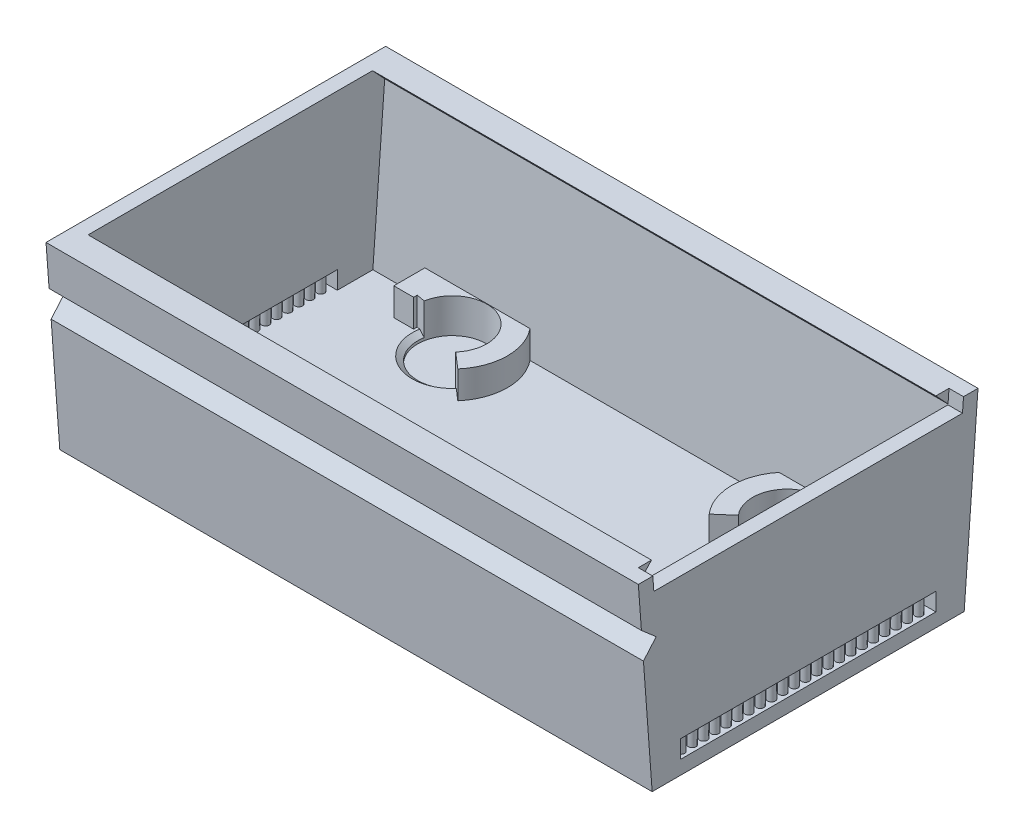
from build123d import *
from OCP.BRepFilletAPI import BRepFilletAPI_MakeChamfer

# Parameters (mm, degrees)
ESBO_O1_W                   = 83.7
ESBO_O1_H                   = 45.2
BASE_DEPTH                  = 2
PAREDES_LATERAIS_DEPTH      = 83.7
PAREDE_CORPO_DEPTH          = 2.1
PAREDE_CABE_A_DEPTH         = 2.1
TRILHO_START                = -2.1
TRILHO_TAMPA_DEPTH          = 81.6
TRILHO_CORE_REACH           = 103.58
CORTE_TRILHO_CORE_DEPTH     = 102.579919275
ESBO_O19_W                  = 37
ESBO_O19_H                  = 2.59
CORTE_CONECTOR_CABE_A_DEPTH = 2.1
ESBO_O20_W                  = 31
ESBO_O20_H                  = 2.59
CORTE_CONECTOR_CORPO_DEPTH  = 2.1
ESBO_O21_W                  = 4
ESBO_O21_H                  = 4.5
APOIO_CONECTOR_CABE_A_DEPTH = 4
ESBO_O22_R                  = 5
CORTE_IM_DEPTH              = 1
RESSALTO_EXTRUS_O15_START   = 4
RESSALTO_EXTRUS_O15_DEPTH   = 4
CHANFRO7_SIZE               = 0.60284324
CHANFRO7_SIZE_2             = 0.8
ESBO_O25_R                  = 0.55
RESSALTO_EXTRUS_O16_DEPTH   = 2.6
ESBO_O27_R                  = 0.55
RESSALTO_EXTRUS_O17_DEPTH   = 2.6
CHANFRO5_SIZE               = 1
CHANFRO5_SIZE2              = 0.75355405
CHANFRO6_SIZE               = 1.5
CHANFRO6_SIZE2              = 1.130331075


with BuildPart() as part:
    # Esboço1 → Base (new body)
    with BuildSketch(Plane(origin=(0, 0, 0), x_dir=(1, 0, 0), z_dir=(0, 1, 0))):
        with Locations((41.85, -22.6)):
            Rectangle(ESBO_O1_W, ESBO_O1_H)
    extrude(amount=BASE_DEPTH)

    # Esboço10 → Paredes Laterais (add, through all)
    with BuildSketch(Plane.ZY):
        Polygon((0, 0), (-2, 27), (0.1, 27), (2.1, 0), align=None)
        Polygon((43.1, 0), (45.2, 0), (47.2, 27), (45.1, 27), align=None)
    extrude(amount=-PAREDES_LATERAIS_DEPTH)

    # Esboço12 → Parede Corpo (add)
    with BuildSketch(Plane.ZY):
        Polygon((45.2, 0), (0, 0), (-2, 27), (47.2, 27), align=None)
    extrude(amount=PAREDE_CORPO_DEPTH)

    # Esboço13 → Parede Cabeça (add)
    with BuildSketch(Plane(origin=(83.7, 0, 0), x_dir=(0, 0, -1), z_dir=(1, 0, 0))):
        Polygon((-47.051851852, 25), (1.851851852, 25), (0, 0), (-45.2, 0), align=None)
    extrude(amount=-PAREDE_CABE_A_DEPTH)

    # Esboço14 → Trilho Tampa (add)
    with BuildSketch(Plane(origin=(83.7, 0, 0), x_dir=(0, 0, -1), z_dir=(1, 0, 0)).offset(TRILHO_START)):
        Polygon((-46.903703704, 23), (-43.2, 27), (-47.2, 27), align=None)
        Polygon((2, 27), (1.703703704, 23), (-2, 27), align=None)
    extrude(amount=-TRILHO_TAMPA_DEPTH)

    # Esboço15 → Trilho Core (add, up to next)
    with BuildSketch(Plane(origin=(83.7, 0, 0), x_dir=(0, 0, -1), z_dir=(1, 0, 0)), mode=Mode.PRIVATE) as trilho_core_sk1:
        Polygon((-46.903703704, 23), (-43.2, 19.263389498), (-46.31273022, 15.021857964), align=None)
    trilho_core_tool1 = extrude(trilho_core_sk1.sketch, amount=-TRILHO_CORE_REACH, mode=Mode.PRIVATE) - part.part
    add(trilho_core_tool1.solids().sort_by_distance((83.7, 19.095082, 45.472145))[0])

    # Esboço18 → Corte Trilho core (cut, through all)
    with BuildSketch(Plane(origin=(83.7, 0, 0), x_dir=(0, 0, -1), z_dir=(1, 0, 0))):
        Polygon((-46.755555556, 21), (-44.613276676, 19.153207862), (-46.460068813, 17.010928982), align=None)
    extrude(amount=-CORTE_TRILHO_CORE_DEPTH, mode=Mode.SUBTRACT)

    # Esboço19 → Corte - Conector Cabeça (cut)
    with BuildSketch(Plane(origin=(83.7, 0, 0), x_dir=(0, 0, -1), z_dir=(1, 0, 0))):
        with Locations((-22.6, 3.295)):
            Rectangle(ESBO_O19_W, ESBO_O19_H)
    extrude(amount=-CORTE_CONECTOR_CABE_A_DEPTH, mode=Mode.SUBTRACT)

    # Esboço20 → Corte-Conector Corpo (cut)
    with BuildSketch(Plane.ZY.offset(2.1)):
        with Locations((22.6, 3.295)):
            Rectangle(ESBO_O20_W, ESBO_O20_H)
    extrude(amount=-CORTE_CONECTOR_CORPO_DEPTH, mode=Mode.SUBTRACT)

    # Esboço21 → Apoio Conector Cabeça (add)
    with BuildSketch(Plane(origin=(0, 2, 0), x_dir=(1, 0, 0), z_dir=(0, 1, 0))):
        Polygon((71.2, -2), (71.2, -4.451851852), (75.2, -4.451851852), (75.2, -1.951851852), align=None)
        Polygon((75.2, -43.248148148), (71.2, -43.2), (71.2, -40.748148148), (75.2, -40.748148148), align=None)
        with Locations((8.4, -4.201851852)):
            Rectangle(ESBO_O21_W, ESBO_O21_H)
        with Locations((8.4, -40.998148148)):
            Rectangle(ESBO_O21_W, ESBO_O21_H)
    extrude(amount=APOIO_CONECTOR_CABE_A_DEPTH)

    # Esboço22 → Corte-imã (cut)
    with BuildSketch(Plane(origin=(0, 2, 0), x_dir=(1, 0, 0), z_dir=(0, 1, 0))):
        with Locations(Location((65.05, -7, 0), (0, 0, 270))):
            Circle(ESBO_O22_R)
        with Locations(Location((16.55, -7, 0), (0, 0, 90))):
            Circle(ESBO_O22_R)
    extrude(amount=-CORTE_IM_DEPTH, mode=Mode.SUBTRACT)

    # Esboço24 → Ressalto-extrusão15 (add)
    with BuildSketch(Plane(origin=(0, 2, 0), x_dir=(1, 0, 0), z_dir=(0, 1, 0)).offset(RESSALTO_EXTRUS_O15_START)):
        with BuildLine():
            ThreePointArc((11.624360744, -6.140885386), (18.696276537, -2.484084032), (20.326592413, -10.276789549))
            Line((20.326592413, -10.276789549), (22.59254786, -12.242863278))
            ThreePointArc((22.59254786, -12.242863278), (24.548989357, -7.127158435), (22.756142141, -1.951851852))
            Line((22.756142141, -1.951851852), (10.4, -1.951851852))
            Line((10.4, -1.951851852), (10.4, -5.92733621))
            Line((10.4, -5.92733621), (11.624360744, -6.140885386))
        make_face()
        with BuildLine():
            Line((71.256142141, -1.951851852), (58.843857859, -1.951851852))
            ThreePointArc((58.843857859, -1.951851852), (57.051010643, -7.127158435), (59.00745214, -12.242863278))
            Line((59.00745214, -12.242863278), (61.273407587, -10.276789549))
            ThreePointArc((61.273407587, -10.276789549), (62.214541124, -2.881726944), (69.458636981, -4.641203704))
            Line((69.458636981, -4.641203704), (71.2, -3.709505164))
            Line((71.2, -3.709505164), (71.2, -2))
            Line((71.2, -2), (71.294091042, -1.998867423))
            ThreePointArc((71.294091042, -1.998867423), (71.275160977, -1.975323811), (71.256142141, -1.951851852))
        make_face()
    extrude(amount=-RESSALTO_EXTRUS_O15_DEPTH)

    # Chanfro7
    # the kernel refuses this chamfer: 0.8, 0.60284324 mm, written as the material it takes off along each edge
    with BuildSketch(Plane(origin=(16.55, 2, 7), x_dir=(-0.9851278512038923, 0, -0.17182292275014302), z_dir=(0.17182292275014302, 0, -0.9851278512038923))) as chanfro7_piece_1:
        Polygon((5, -CHANFRO7_SIZE), (5 + CHANFRO7_SIZE_2, 0), (5, 0), align=None)
    revolve(axis=Axis((16.55, 2, 7), (0, 1, 0)), revolution_arc=148.947030432, mode=Mode.SUBTRACT)
    with BuildSketch(Plane(origin=(65.05, 2, 7), x_dir=(0, 0, 1), z_dir=(-1, 0, 0))) as chanfro7_piece_2:
        Polygon((5, -CHANFRO7_SIZE), (5 + CHANFRO7_SIZE_2, 0), (5, 0), align=None)
    revolve(axis=Axis((65.05, 2, 7), (0, 1, 0)), revolution_arc=118.148554584, mode=Mode.SUBTRACT)
    with BuildSketch(Plane(origin=(65.05, 2, 7), x_dir=(-0.7553184825362543, 0, 0.6553579098013009), z_dir=(-0.6553579098013009, 0, -0.7553184825362543))) as chanfro7_piece_3:
        Polygon((5, -CHANFRO7_SIZE), (5 + CHANFRO7_SIZE_2, 0), (5, 0), align=None)
    revolve(axis=Axis((65.05, 2, 7), (0, 1, 0)), revolution_arc=49.053205856, mode=Mode.SUBTRACT)

    # Esboço25 → Ressalto-extrusão16 (add)
    with BuildSketch(Plane(origin=(0, 2, 0), x_dir=(1, 0, 0), z_dir=(0, 1, 0))):
        with Locations(Location((82.7, -5.6, 0), (0, 0, 270))):
            Circle(ESBO_O25_R)
        with Locations(Location((82.7, -7.24, 0), (0, 0, 270))):
            Circle(ESBO_O25_R)
        with Locations(Location((82.7, -8.88, 0), (0, 0, 270))):
            Circle(ESBO_O25_R)
        with Locations(Location((82.7, -10.52, 0), (0, 0, 270))):
            Circle(ESBO_O25_R)
        with Locations(Location((82.7, -12.16, 0), (0, 0, 270))):
            Circle(ESBO_O25_R)
        with Locations(Location((82.7, -13.8, 0), (0, 0, 270))):
            Circle(ESBO_O25_R)
        with Locations(Location((82.7, -15.44, 0), (0, 0, 270))):
            Circle(ESBO_O25_R)
        with Locations(Location((82.7, -17.08, 0), (0, 0, 270))):
            Circle(ESBO_O25_R)
        with Locations(Location((82.7, -18.72, 0), (0, 0, 270))):
            Circle(ESBO_O25_R)
        with Locations(Location((82.7, -20.36, 0), (0, 0, 270))):
            Circle(ESBO_O25_R)
        with Locations(Location((82.7, -22, 0), (0, 0, 270))):
            Circle(ESBO_O25_R)
        with Locations(Location((82.7, -23.64, 0), (0, 0, 270))):
            Circle(ESBO_O25_R)
        with Locations(Location((82.7, -25.28, 0), (0, 0, 270))):
            Circle(ESBO_O25_R)
        with Locations(Location((82.7, -26.92, 0), (0, 0, 270))):
            Circle(ESBO_O25_R)
        with Locations(Location((82.7, -28.56, 0), (0, 0, 270))):
            Circle(ESBO_O25_R)
        with Locations(Location((82.7, -30.2, 0), (0, 0, 270))):
            Circle(ESBO_O25_R)
        with Locations(Location((82.7, -31.84, 0), (0, 0, 270))):
            Circle(ESBO_O25_R)
        with Locations(Location((82.7, -33.48, 0), (0, 0, 270))):
            Circle(ESBO_O25_R)
        with Locations(Location((82.7, -35.12, 0), (0, 0, 270))):
            Circle(ESBO_O25_R)
        with Locations(Location((82.7, -36.76, 0), (0, 0, 270))):
            Circle(ESBO_O25_R)
        with Locations(Location((82.7, -38.4, 0), (0, 0, 270))):
            Circle(ESBO_O25_R)
        with Locations(Location((82.7, -40.04, 0), (0, 0, 270))):
            Circle(ESBO_O25_R)
    extrude(amount=RESSALTO_EXTRUS_O16_DEPTH)

    # Esboço27 → Ressalto-extrusão17 (add)
    with BuildSketch(Plane(origin=(0, 2, 0), x_dir=(1, 0, 0), z_dir=(0, 1, 0))):
        with Locations(Location((-1.1, -8.4, 0), (0, 0, 270))):
            Circle(ESBO_O27_R)
        with Locations(Location((-1.1, -10, 0), (0, 0, 270))):
            Circle(ESBO_O27_R)
        with Locations(Location((-1.1, -11.6, 0), (0, 0, 270))):
            Circle(ESBO_O27_R)
        with Locations(Location((-1.1, -13.2, 0), (0, 0, 270))):
            Circle(ESBO_O27_R)
        with Locations(Location((-1.1, -14.8, 0), (0, 0, 270))):
            Circle(ESBO_O27_R)
        with Locations(Location((-1.1, -16.4, 0), (0, 0, 270))):
            Circle(ESBO_O27_R)
        with Locations(Location((-1.1, -18, 0), (0, 0, 270))):
            Circle(ESBO_O27_R)
        with Locations(Location((-1.1, -19.6, 0), (0, 0, 270))):
            Circle(ESBO_O27_R)
        with Locations(Location((-1.1, -21.2, 0), (0, 0, 270))):
            Circle(ESBO_O27_R)
        with Locations(Location((-1.1, -22.8, 0), (0, 0, 270))):
            Circle(ESBO_O27_R)
        with Locations(Location((-1.1, -24.4, 0), (0, 0, 270))):
            Circle(ESBO_O27_R)
        with Locations(Location((-1.1, -26, 0), (0, 0, 270))):
            Circle(ESBO_O27_R)
        with Locations(Location((-1.1, -27.6, 0), (0, 0, 270))):
            Circle(ESBO_O27_R)
        with Locations(Location((-1.1, -29.2, 0), (0, 0, 270))):
            Circle(ESBO_O27_R)
        with Locations(Location((-1.1, -30.8, 0), (0, 0, 270))):
            Circle(ESBO_O27_R)
        with Locations(Location((-1.1, -32.4, 0), (0, 0, 270))):
            Circle(ESBO_O27_R)
        with Locations(Location((-1.1, -34, 0), (0, 0, 270))):
            Circle(ESBO_O27_R)
        with Locations(Location((-1.1, -35.6, 0), (0, 0, 270))):
            Circle(ESBO_O27_R)
        with Locations(Location((-1.1, -37.2, 0), (0, 0, 270))):
            Circle(ESBO_O27_R)
    extrude(amount=RESSALTO_EXTRUS_O17_DEPTH)

    # Chanfro5: one chamfer whose edges measure the first distance from different faces: ONE call of the kernel's chamfer builder (chamfer() names one face for all edges)
    chanfro5_edges_1 = [part.edges().sort_by_distance(p)[0] for p in [
        (75.2, 4, 4.451851852),
    ]]
    chanfro5_side_1 = [part.faces().sort_by_distance(p)[0] for p in [
        (73.2, 4, 4.451851852),
    ]]
    chanfro5_edges_2 = [part.edges().sort_by_distance(p)[0] for p in [
        (75.2, 6, 3.201851852),
    ]]
    chanfro5_side_2 = [part.faces().sort_by_distance(p)[0] for p in [
        (65.05, 6, 1.972716353),
    ]]
    chanfro5_edges_3 = [part.edges().sort_by_distance(p)[0] for p in [
        (75.2, 4, 40.748148148),
        (75.2, 6, 41.998148148),
    ]]
    chanfro5_side_3 = [part.faces().sort_by_distance(p)[0] for p in [
        (75.2, 4, 41.998148148),
    ]]
    chanfro5 = BRepFilletAPI_MakeChamfer(part.part.solid().wrapped)
    for e in chanfro5_edges_1:
        chanfro5.Add(CHANFRO5_SIZE, CHANFRO5_SIZE2, e.wrapped, chanfro5_side_1[0].wrapped)  # the first distance lies on this face
    for e in chanfro5_edges_2:
        chanfro5.Add(CHANFRO5_SIZE, CHANFRO5_SIZE2, e.wrapped, chanfro5_side_2[0].wrapped)  # the first distance lies on this face
    for e in chanfro5_edges_3:
        chanfro5.Add(CHANFRO5_SIZE, CHANFRO5_SIZE2, e.wrapped, chanfro5_side_3[0].wrapped)  # the first distance lies on this face
    add(Compound.cast(chanfro5.Shape()), mode=Mode.REPLACE)

    # Chanfro6: one chamfer whose edges measure the first distance from different faces: ONE call of the kernel's chamfer builder (chamfer() names one face for all edges)
    chanfro6_edges_1 = [part.edges().sort_by_distance(p)[0] for p in [
        (6.4, 4, 6.451851852),
        (6.4, 6, 4.201851852),
    ]]
    chanfro6_side_1 = [part.faces().sort_by_distance(p)[0] for p in [
        (6.4, 4, 4.201851852),
    ]]
    chanfro6_edges_2 = [part.edges().sort_by_distance(p)[0] for p in [
        (6.4, 4, 38.748148148),
    ]]
    chanfro6_side_2 = [part.faces().sort_by_distance(p)[0] for p in [
        (8.4, 4, 38.748148148),
    ]]
    chanfro6_edges_3 = [part.edges().sort_by_distance(p)[0] for p in [
        (6.4, 6, 40.998148148),
    ]]
    chanfro6_side_3 = [part.faces().sort_by_distance(p)[0] for p in [
        (8.4, 6, 40.998148148),
    ]]
    chanfro6 = BRepFilletAPI_MakeChamfer(part.part.solid().wrapped)
    for e in chanfro6_edges_1:
        chanfro6.Add(CHANFRO6_SIZE, CHANFRO6_SIZE2, e.wrapped, chanfro6_side_1[0].wrapped)  # the first distance lies on this face
    for e in chanfro6_edges_2:
        chanfro6.Add(CHANFRO6_SIZE, CHANFRO6_SIZE2, e.wrapped, chanfro6_side_2[0].wrapped)  # the first distance lies on this face
    for e in chanfro6_edges_3:
        chanfro6.Add(CHANFRO6_SIZE, CHANFRO6_SIZE2, e.wrapped, chanfro6_side_3[0].wrapped)  # the first distance lies on this face
    add(Compound.cast(chanfro6.Shape()), mode=Mode.REPLACE)


solid = part.part
